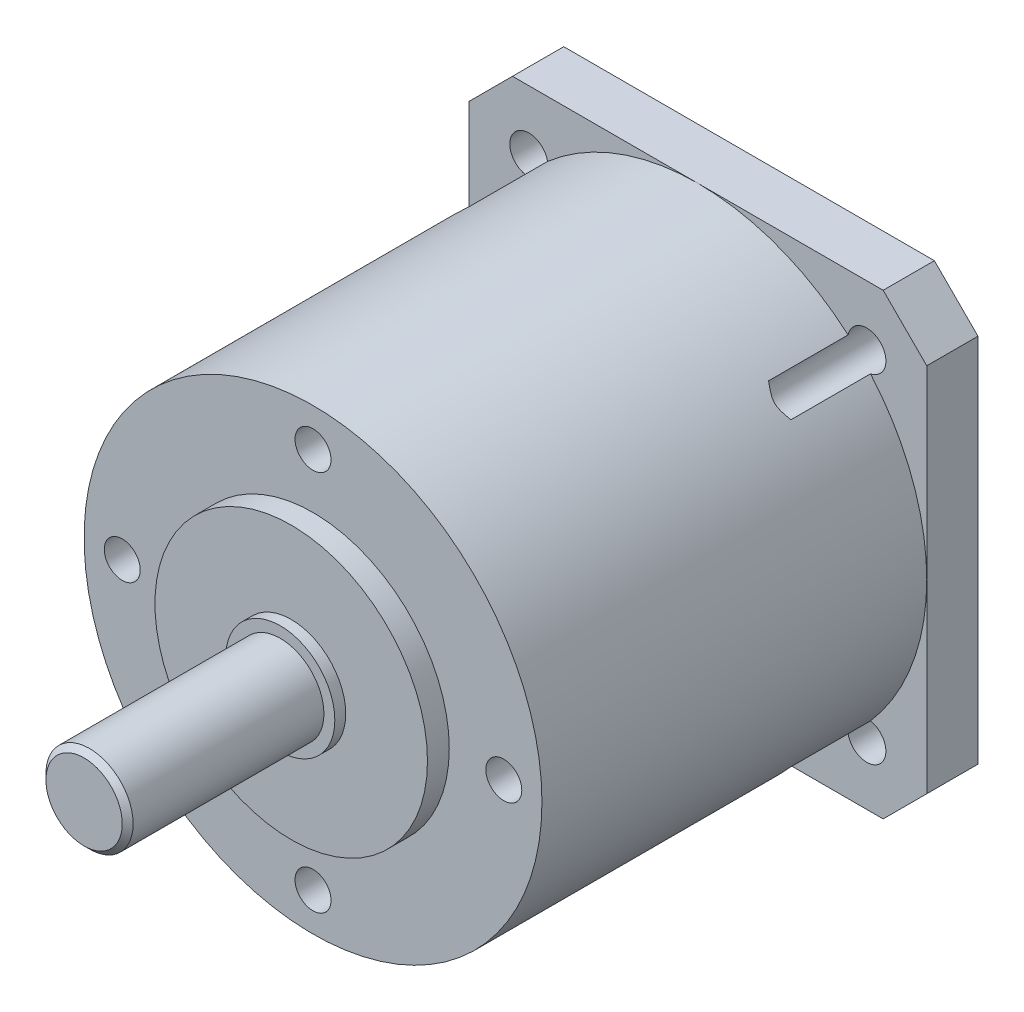
from build123d import *

# Parameters (mm, degrees)
BOSS_EXTRUDE1_DEPTH = 4.7
SKETCH2_R           = 21
BOSS_EXTRUDE2_DEPTH = 35.3
SKETCH9_R           = 12.5
BOSS_EXTRUDE3_DEPTH = 2
SKETCH10_R          = 5
BOSS_EXTRUDE4_DEPTH = 1
SKETCH11_R          = 4
BOSS_EXTRUDE5_DEPTH = 18
CHAMFER1_SIZE       = 0.5


# Read off the part's stored shape, not the designer's step: Ø3.5 (3.5) Diameter Hole1, Tap Drill for M4x0.7 Tap1
with BuildPart() as part:
    # Sketch1 → Boss-Extrude1 (new body)
    with BuildSketch(Plane.XY):
        Polygon((-21, 17), (-17, 21), (17, 21), (21, 17), (21, -17), (17, -21), (-17, -21), (-21, -17), align=None)
    extrude(amount=BOSS_EXTRUDE1_DEPTH)

    # Sketch2 → Boss-Extrude2 (add)
    with BuildSketch(Plane.XY.offset(4.7)):
        Circle(SKETCH2_R)
    extrude(amount=BOSS_EXTRUDE2_DEPTH)

    # Ø3.5 (3.5) Diameter Hole1 outline → Ø3.5 (3.5) Diameter Hole1 (revolve, cut)
    with BuildSketch(Plane(origin=(-15.5, 15.5, 0), x_dir=(1, 0, 0), z_dir=(0, -1, 0))):
        Polygon((1.75, 0), (1.75, 12), (0.919892113, 12.498779139), (0, 12.498779139), (0, 0), align=None)
    revolve(axis=Axis((-15.5, 15.5, 0), (0, 0, 1)), mode=Mode.SUBTRACT)

    # 3.5 _3.5_ Diameter Hole1 2 outline → 3.5 _3.5_ Diameter Hole1 2 (revolve, cut)
    with BuildSketch(Plane(origin=(15.5, -15.5, 0), x_dir=(1, 0, 0), z_dir=(0, -1, 0))):
        Polygon((1.75, 0), (1.75, 12), (0.919892113, 12.498779139), (0, 12.498779139), (0, 0), align=None)
    revolve(axis=Axis((15.5, -15.5, 0), (0, 0, 1)), mode=Mode.SUBTRACT)

    # 3.5 _3.5_ Diameter Hole1 3 outline → 3.5 _3.5_ Diameter Hole1 3 (revolve, cut)
    with BuildSketch(Plane(origin=(15.5, 15.5, 0), x_dir=(1, 0, 0), z_dir=(0, -1, 0))):
        Polygon((1.75, 0), (1.75, 12), (0.919892113, 12.498779139), (0, 12.498779139), (0, 0), align=None)
    revolve(axis=Axis((15.5, 15.5, 0), (0, 0, 1)), mode=Mode.SUBTRACT)

    # 3.5 _3.5_ Diameter Hole1 4 outline → 3.5 _3.5_ Diameter Hole1 4 (revolve, cut)
    with BuildSketch(Plane(origin=(-15.5, -15.5, 0), x_dir=(1, 0, 0), z_dir=(0, -1, 0))):
        Polygon((1.75, 0), (1.75, 12), (0.919892113, 12.498779139), (0, 12.498779139), (0, 0), align=None)
    revolve(axis=Axis((-15.5, -15.5, 0), (0, 0, 1)), mode=Mode.SUBTRACT)

    # Tap Drill for M4x0.7 Tap1 outline → Tap Drill for M4x0.7 Tap1 (revolve, cut)
    with BuildSketch(Plane(origin=(17.5, 0, 0), x_dir=(1, 0, 0), z_dir=(0, -1, 0))):
        Polygon((0, 40), (0, 31.008579979), (1.65, 32), (1.65, 40), align=None)
    revolve(axis=Axis((17.5, 0, 0), (0, 0, 1)), mode=Mode.SUBTRACT)

    # Tap Drill for M4x0.7 Tap1 2 outline → Tap Drill for M4x0.7 Tap1 2 (revolve, cut)
    with BuildSketch(Plane(origin=(-17.5, 0, 0), x_dir=(1, 0, 0), z_dir=(0, -1, 0))):
        Polygon((0, 40), (0, 31.008579979), (1.65, 32), (1.65, 40), align=None)
    revolve(axis=Axis((-17.5, 0, 0), (0, 0, 1)), mode=Mode.SUBTRACT)

    # Tap Drill for M4x0.7 Tap1 3 outline → Tap Drill for M4x0.7 Tap1 3 (revolve, cut)
    with BuildSketch(Plane.XZ.offset(17.5)):
        Polygon((0, 40), (0, 31.008579979), (1.65, 32), (1.65, 40), align=None)
    revolve(axis=Axis((0, -17.5, 0), (0, 0, 1)), mode=Mode.SUBTRACT)

    # Tap Drill for M4x0.7 Tap1 4 outline → Tap Drill for M4x0.7 Tap1 4 (revolve, cut)
    with BuildSketch(Plane.XZ.offset(-17.5)):
        Polygon((0, 40), (0, 31.008579979), (1.65, 32), (1.65, 40), align=None)
    revolve(axis=Axis((0, 17.5, 0), (0, 0, 1)), mode=Mode.SUBTRACT)

    # Sketch9 → Boss-Extrude3 (add)
    with BuildSketch(Plane.XY.offset(40)):
        Circle(SKETCH9_R)
    extrude(amount=BOSS_EXTRUDE3_DEPTH)

    # Sketch10 → Boss-Extrude4 (add)
    with BuildSketch(Plane.XY.offset(42)):
        Circle(SKETCH10_R)
    extrude(amount=BOSS_EXTRUDE4_DEPTH)

    # Sketch11 → Boss-Extrude5 (add)
    with BuildSketch(Plane.XY.offset(43)):
        Circle(SKETCH11_R)
    extrude(amount=BOSS_EXTRUDE5_DEPTH)

    # Chamfer1
    chamfer1_edges = [part.edges().sort_by_distance(p)[0] for p in [
        (-4, 0, 61),
    ]]
    chamfer(chamfer1_edges, length=CHAMFER1_SIZE)


solid = part.part
